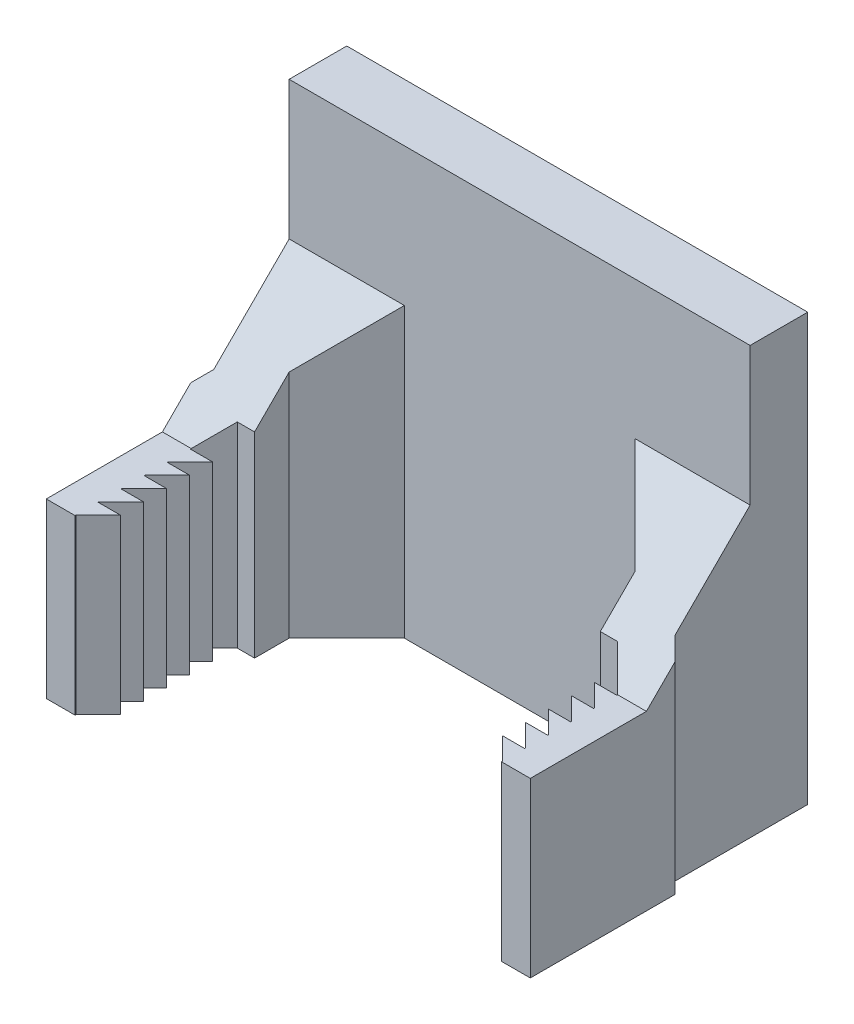
from build123d import *

# Parameters (mm, degrees)
BOSS_EXTRUDE1_DEPTH = 15
SKETCH3_R           = 3.05
CUT_EXTRUDE1_DEPTH  = 15
CUT_EXTRUDE3_DEPTH  = 59.485528143
SKETCH5_W           = 12.5375
SKETCH5_H           = 15
BOSS_EXTRUDE2_DEPTH = 1
CHAMFER1_SIZE       = 1
SKETCH6_W           = 40
SKETCH6_H           = 37
BOSS_EXTRUDE3_DEPTH = 5
CHAMFER2_SIZE       = 10


# Some blends are built 0.0001 mm under size
with BuildPart() as part:
    # Sketch2 → Boss-Extrude1 (new body)
    with BuildSketch(Plane(origin=(0, 0, 0), x_dir=(1, 0, 0), z_dir=(0, 1, 0))):
        Polygon((-13.5, 0), (6.5, 0), (11.5, -5), (11.5, -41), (31.917309801, -41), (31.917309801, -35.69895288), (16.5, -35.69895288), (16.5, 5), (-23.5, 5), (-23.5, -35.69895288), (-38.917309801, -35.69895288), (-38.917309801, -41), (-18.5, -41), (-18.5, -5), align=None)
    extrude(amount=BOSS_EXTRUDE1_DEPTH)

    # Sketch3 → Cut-Extrude1 (cut)
    with BuildSketch(Plane(origin=(0, 0, 35.69895288), x_dir=(-1, 0, 0), z_dir=(0, 0, -1))):
        with Locations((26.5, 9)):
            Circle(SKETCH3_R)
        with Locations((-23.5, 9)):
            Circle(SKETCH3_R)
    extrude(amount=-CUT_EXTRUDE1_DEPTH, mode=Mode.SUBTRACT)

    # Sketch4 → Cut-Extrude3 (cut, through all)
    with BuildSketch(Plane(origin=(0, 15, 0), x_dir=(1, 0, 0), z_dir=(0, 1, 0))):
        Polygon((-22, -10.075), (-20.075, -10.075), (-22, -12), (-22, -12.075), (-20.075, -12.075), (-22, -14), (-22, -14.075), (-20.075, -14.075), (-22, -16), (-22, -16.075), (-20.075, -16.075), (-22, -18), (-22, -18.075), (-20.075, -18.075), (-22, -20), (-22, -20.075), (-23.5, -20.075), (-23.5, -35.69895288), (-38.917309801, -35.69895288), (-38.917309801, -41), (-18.5, -41), (-18.5, -16.075), (-18.5, -8), (-20, -8), (-22, -10), align=None)
        Polygon((13, -8), (11.5, -8), (11.5, -41), (31.917309801, -41), (31.917309801, -35.69895288), (16.5, -35.69895288), (16.5, -20.075), (15, -20.075), (15, -20), (13.075, -18.075), (15, -18.075), (15, -18), (13.075, -16.075), (15, -16.075), (15, -16), (13.075, -14.075), (15, -14.075), (15, -14), (13.075, -12.075), (15, -12.075), (15, -12), (13.075, -10.075), (15, -10.075), (15, -10), align=None)
    extrude(amount=-CUT_EXTRUDE3_DEPTH, mode=Mode.SUBTRACT)

    # Sketch5 → Boss-Extrude2 (add)
    with BuildSketch(Plane.ZY.offset(23.5)):
        with Locations((13.80625, 7.5)):
            Rectangle(SKETCH5_W, SKETCH5_H)
    boss_extrude2 = extrude(amount=BOSS_EXTRUDE2_DEPTH)

    # Mirror1: Boss-Extrude2 across plane
    add(boss_extrude2.mirror(Plane(origin=(-3.5, 0, 0), x_dir=(0, 0, 1), z_dir=(1, 0, 0))))

    # Chamfer1
    chamfer1_edges = [part.edges().sort_by_distance(p)[0] for p in [
        (16.5, 7.5, 7.5375),
        (-23.5, 7.5, 7.5375),
    ]]
    chamfer(chamfer1_edges, length=CHAMFER1_SIZE - 0.0001)  # a hair under: the kernel refuses the full size

    # Sketch6 → Boss-Extrude3 (add)
    with BuildSketch(Plane(origin=(0, 0, -5), x_dir=(-1, 0, 0), z_dir=(0, 0, -1))):
        with Locations((3.5, 18.5)):
            Rectangle(SKETCH6_W, SKETCH6_H)
    extrude(amount=-BOSS_EXTRUDE3_DEPTH)

    # Chamfer2
    # the kernel refuses this chamfer: 10 mm, written as the material it adds along each edge
    with BuildSketch(Plane(origin=(42.21682988, 15, 0), x_dir=(0, -0.027495876610586317, 0.9996219169112968), z_dir=(-1, 0, 0))) as chamfer2_piece_1_section:
        Polygon((CHAMFER2_SIZE * 0.999621916911, CHAMFER2_SIZE * 0.0274958766106), (-CHAMFER2_SIZE * 0.0274958766106, CHAMFER2_SIZE * 0.999621916911), (0, 0), align=None)
    chamfer2_piece_1 = extrude(amount=61.433659759, mode=Mode.PRIVATE)
    chamfer2_piece_1 = split(chamfer2_piece_1, bisect_by=Plane(origin=(15.01875, 16.231233333, 10.01875), z_dir=(0.7071067811865479, 0, -0.7071067811865472)), keep=Keep.TOP, mode=Mode.PRIVATE)
    chamfer2_piece_1 = split(chamfer2_piece_1, bisect_by=Plane(origin=(17.5, 16.231233333, 7.537533333), z_dir=(-1, 0, 0)), keep=Keep.TOP, mode=Mode.PRIVATE)
    chamfer2_piece_1 = split(chamfer2_piece_1, bisect_by=Plane(origin=(17.499966667, 16.231233333, 7.5375), z_dir=(0, 0, 1)), keep=Keep.TOP, mode=Mode.PRIVATE)
    with BuildSketch(Plane(origin=(16.5, 15, 0), x_dir=(0, -0.027495876610586317, 0.9996219169112968), z_dir=(-1, 0, 0))) as chamfer2_piece_2_section:
        Polygon((CHAMFER2_SIZE * 0.999621916911, CHAMFER2_SIZE * 0.0274958766106), (-CHAMFER2_SIZE * 0.0274958766106, CHAMFER2_SIZE * 0.999621916911), (0, 0), align=None)
    chamfer2_piece_2 = extrude(amount=35.71682988, mode=Mode.PRIVATE)
    chamfer2_piece_2 = split(chamfer2_piece_2, bisect_by=Plane(origin=(15.769248019, 18.74844553, 8), z_dir=(0, 0, -1)), keep=Keep.TOP, mode=Mode.PRIVATE)
    chamfer2_piece_2 = split(chamfer2_piece_2, bisect_by=Plane(origin=(11.5, 18.74844553, 2.503108939), z_dir=(1, 0, 0)), keep=Keep.TOP, mode=Mode.PRIVATE)
    with BuildSketch(Plane(origin=(42.21682988, 15, 0), x_dir=(0, -0.027495876610586317, 0.9996219169112968), z_dir=(-1, 0, 0))) as chamfer2_piece_3_section:
        Polygon((CHAMFER2_SIZE * 0.999621916911, CHAMFER2_SIZE * 0.0274958766106), (-CHAMFER2_SIZE * 0.0274958766106, CHAMFER2_SIZE * 0.999621916911), (0, 0), align=None)
    chamfer2_piece_3 = extrude(amount=61.433659759, mode=Mode.PRIVATE)
    chamfer2_piece_3 = split(chamfer2_piece_3, bisect_by=Plane(origin=(16.985049673, 16.407833551, 7.022649673), z_dir=(-0.7071067811865476, 0, 0.7071067811865476)), keep=Keep.TOP, mode=Mode.PRIVATE)
    chamfer2_piece_3 = split(chamfer2_piece_3, bisect_by=Plane(origin=(15.253849673, 16.407833551, 8.753849673), z_dir=(0.7071067811865476, 0, -0.7071067811865476)), keep=Keep.TOP, mode=Mode.PRIVATE)
    chamfer2_piece_3 = split(chamfer2_piece_3, bisect_by=Plane(origin=(17.5, 16.407833551, 7.184332898), z_dir=(-1, 0, 0)), keep=Keep.TOP, mode=Mode.PRIVATE)
    with BuildSketch(Plane(origin=(42.21682988, 15, 0), x_dir=(0, -0.027495876610586317, 0.9996219169112968), z_dir=(-1, 0, 0))) as chamfer2_piece_4_section:
        Polygon((CHAMFER2_SIZE * 0.999621916911, CHAMFER2_SIZE * 0.0274958766106), (-CHAMFER2_SIZE * 0.0274958766106, CHAMFER2_SIZE * 0.999621916911), (0, 0), align=None)
    chamfer2_piece_4 = extrude(amount=61.433659759, mode=Mode.PRIVATE)
    chamfer2_piece_4 = split(chamfer2_piece_4, bisect_by=Plane(origin=(8.989616943, 19.750655371, 2.489616943), z_dir=(0.7071067811865476, 0, -0.7071067811865476)), keep=Keep.TOP, mode=Mode.PRIVATE)
    chamfer2_piece_4 = split(chamfer2_piece_4, bisect_by=Plane(origin=(15, 19.750655371, 0.498689257), z_dir=(-1, 0, 0)), keep=Keep.TOP, mode=Mode.PRIVATE)
    with BuildSketch(Plane(origin=(42.21682988, 15, 0), x_dir=(0, -0.027495876610586317, 0.9996219169112968), z_dir=(-1, 0, 0))) as chamfer2_piece_5_section:
        Polygon((CHAMFER2_SIZE * 0.999621916911, CHAMFER2_SIZE * 0.0274958766106), (-CHAMFER2_SIZE * 0.0274958766106, CHAMFER2_SIZE * 0.999621916911), (0, 0), align=None)
    chamfer2_piece_5 = extrude(amount=61.433659759, mode=Mode.PRIVATE)
    chamfer2_piece_5 = split(chamfer2_piece_5, bisect_by=Plane(origin=(-18.5, 16.119619514, 7.760760971), z_dir=(-1, 0, 0)), keep=Keep.TOP, mode=Mode.PRIVATE)
    chamfer2_piece_5 = split(chamfer2_piece_5, bisect_by=Plane(origin=(-18.85841494, 16.119619514, 8), z_dir=(0, 0, -1)), keep=Keep.TOP, mode=Mode.PRIVATE)
    with BuildSketch(Plane(origin=(42.21682988, 15, 0), x_dir=(0, -0.027495876610586317, 0.9996219169112968), z_dir=(-1, 0, 0))) as chamfer2_piece_6_section:
        Polygon((CHAMFER2_SIZE * 0.999621916911, CHAMFER2_SIZE * 0.0274958766106), (-CHAMFER2_SIZE * 0.0274958766106, CHAMFER2_SIZE * 0.999621916911), (0, 0), align=None)
    chamfer2_piece_6 = extrude(amount=61.433659759, mode=Mode.PRIVATE)
    chamfer2_piece_6 = split(chamfer2_piece_6, bisect_by=Plane(origin=(-15.875, 19.25, 2.375), z_dir=(-0.7071067811865475, 0, -0.7071067811865477)), keep=Keep.TOP, mode=Mode.PRIVATE)
    with BuildSketch(Plane(origin=(12.21682988, 15, 0), x_dir=(0, -0.027495876610586317, 0.9996219169112968), z_dir=(-1, 0, 0))) as chamfer2_piece_7_section:
        Polygon((CHAMFER2_SIZE * 0.999621916911, CHAMFER2_SIZE * 0.0274958766106), (-CHAMFER2_SIZE * 0.0274958766106, CHAMFER2_SIZE * 0.999621916911), (0, 0), align=None)
    chamfer2_piece_7 = extrude(amount=61.433659759, mode=Mode.PRIVATE)
    chamfer2_piece_7 = split(chamfer2_piece_7, bisect_by=Plane(origin=(11.85841494, 16.119619514, 8), z_dir=(0, 0, -1)), keep=Keep.TOP, mode=Mode.PRIVATE)
    chamfer2_piece_7 = split(chamfer2_piece_7, bisect_by=Plane(origin=(11.5, 16.119619514, 7.760760971), z_dir=(1, 0, 0)), keep=Keep.TOP, mode=Mode.PRIVATE)
    with BuildSketch(Plane(origin=(12.21682988, 15, 0), x_dir=(0, -0.027495876610586317, 0.9996219169112968), z_dir=(-1, 0, 0))) as chamfer2_piece_8_section:
        Polygon((CHAMFER2_SIZE * 0.999621916911, CHAMFER2_SIZE * 0.0274958766106), (-CHAMFER2_SIZE * 0.0274958766106, CHAMFER2_SIZE * 0.999621916911), (0, 0), align=None)
    chamfer2_piece_8 = extrude(amount=35.71682988, mode=Mode.PRIVATE)
    chamfer2_piece_8 = split(chamfer2_piece_8, bisect_by=Plane(origin=(-18.5, 16.112575477, 7.774849047), z_dir=(-1, 0, 0)), keep=Keep.TOP, mode=Mode.PRIVATE)
    chamfer2_piece_8 = split(chamfer2_piece_8, bisect_by=Plane(origin=(-19.137424523, 16.112575477, 8), z_dir=(0, 0, -1)), keep=Keep.TOP, mode=Mode.PRIVATE)
    with BuildSketch(Plane(origin=(12.21682988, 15, 0), x_dir=(0, -0.027495876610586317, 0.9996219169112968), z_dir=(-1, 0, 0))) as chamfer2_piece_9_section:
        Polygon((CHAMFER2_SIZE * 0.999621916911, CHAMFER2_SIZE * 0.0274958766106), (-CHAMFER2_SIZE * 0.0274958766106, CHAMFER2_SIZE * 0.999621916911), (0, 0), align=None)
    chamfer2_piece_9 = extrude(amount=61.433659759, mode=Mode.PRIVATE)
    chamfer2_piece_9 = split(chamfer2_piece_9, bisect_by=Plane(origin=(-18.5, 15.733974359, 8.532051282), z_dir=(-1, 0, 0)), keep=Keep.TOP, mode=Mode.PRIVATE)
    chamfer2_piece_9 = split(chamfer2_piece_9, bisect_by=Plane(origin=(-20.863782051, 15.733974359, 8.863782051), z_dir=(-0.7071067811865476, 0, -0.7071067811865476)), keep=Keep.TOP, mode=Mode.PRIVATE)
    chamfer2_piece_9 = split(chamfer2_piece_9, bisect_by=Plane(origin=(-24.5, 15.733974359, 8.532051282), z_dir=(1, 0, 0)), keep=Keep.TOP, mode=Mode.PRIVATE)
    chamfer2_piece_9 = split(chamfer2_piece_9, bisect_by=Plane(origin=(-23.344982051, 15.733974359, 6.382582051), z_dir=(0.7071067811865476, 0, 0.7071067811865476)), keep=Keep.TOP, mode=Mode.PRIVATE)
    with BuildSketch(Plane(origin=(12.21682988, 15, 0), x_dir=(0, -0.027495876610586317, 0.9996219169112968), z_dir=(-1, 0, 0))) as chamfer2_piece_10_section:
        Polygon((CHAMFER2_SIZE * 0.999621916911, CHAMFER2_SIZE * 0.0274958766106), (-CHAMFER2_SIZE * 0.0274958766106, CHAMFER2_SIZE * 0.999621916911), (0, 0), align=None)
    chamfer2_piece_10 = extrude(amount=61.433659759, mode=Mode.PRIVATE)
    chamfer2_piece_10 = split(chamfer2_piece_10, bisect_by=Plane(origin=(8.875, 19.25, 2.375), z_dir=(0.7071067811865476, 0, -0.7071067811865476)), keep=Keep.TOP, mode=Mode.PRIVATE)
    with BuildSketch(Plane(origin=(12.21682988, 15, 0), x_dir=(0, -0.027495876610586317, 0.9996219169112968), z_dir=(-1, 0, 0))) as chamfer2_piece_11_section:
        Polygon((CHAMFER2_SIZE * 0.999621916911, CHAMFER2_SIZE * 0.0274958766106), (-CHAMFER2_SIZE * 0.0274958766106, CHAMFER2_SIZE * 0.999621916911), (0, 0), align=None)
    chamfer2_piece_11 = extrude(amount=35.71682988, mode=Mode.PRIVATE)
    chamfer2_piece_11 = split(chamfer2_piece_11, bisect_by=Plane(origin=(-15.86117072, 19.18959267, 2.36117072), z_dir=(-0.7071067811865475, 0, -0.7071067811865477)), keep=Keep.TOP, mode=Mode.PRIVATE)
    with BuildSketch(Plane(origin=(12.21682988, 15, 0), x_dir=(0, -0.027495876610586317, 0.9996219169112968), z_dir=(-1, 0, 0))) as chamfer2_piece_12_section:
        Polygon((CHAMFER2_SIZE * 0.999621916911, CHAMFER2_SIZE * 0.0274958766106), (-CHAMFER2_SIZE * 0.0274958766106, CHAMFER2_SIZE * 0.999621916911), (0, 0), align=None)
    chamfer2_piece_12 = extrude(amount=61.433659759, mode=Mode.PRIVATE)
    chamfer2_piece_12 = split(chamfer2_piece_12, bisect_by=Plane(origin=(-24.5, 16.231233333, 7.537533333), z_dir=(1, 0, 0)), keep=Keep.TOP, mode=Mode.PRIVATE)
    chamfer2_piece_12 = split(chamfer2_piece_12, bisect_by=Plane(origin=(-24.499966667, 16.231233333, 7.5375), z_dir=(0, 0, 1)), keep=Keep.TOP, mode=Mode.PRIVATE)
    chamfer2_piece_12 = split(chamfer2_piece_12, bisect_by=Plane(origin=(-23.5, 16.231233333, 7.537533333), z_dir=(-1, 0, 0)), keep=Keep.TOP, mode=Mode.PRIVATE)
    add([chamfer2_piece_1, chamfer2_piece_2, chamfer2_piece_3, chamfer2_piece_4, chamfer2_piece_5, chamfer2_piece_6, chamfer2_piece_7, chamfer2_piece_8, chamfer2_piece_9, chamfer2_piece_10, chamfer2_piece_11, chamfer2_piece_12])


solid = part.part
